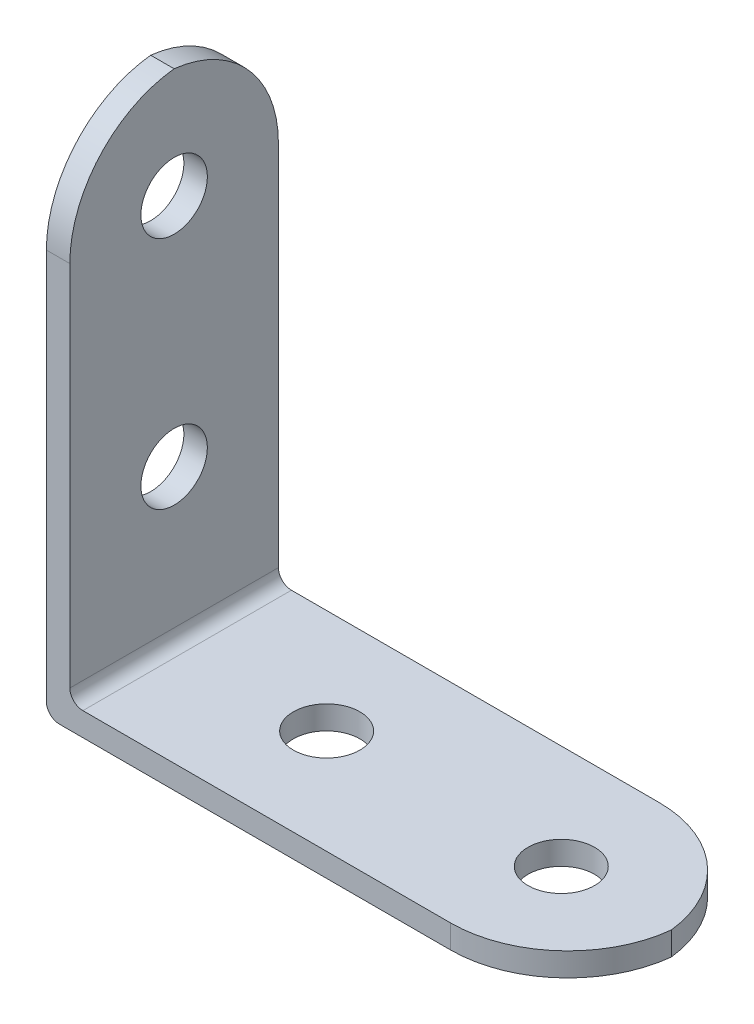
from build123d import *

# Parameters (mm, degrees)
CROQUIS1_W              = 16
CROQUIS1_H              = 40
CROQUIS1_R              = 2.55
SALIENTE_EXTRUIR1_DEPTH = 1.8
CROQUIS2_W              = 16
CROQUIS2_H              = 1.8
SALIENTE_EXTRUIR2_DEPTH = 38.2
CROQUIS3_R              = 2.55
CORTAR_EXTRUIR1_DEPTH   = 38.2
REDONDEO1_R             = 1
REDONDEO2_R             = 9
REDONDEO3_R             = 1


with BuildPart() as part:
    # Croquis1 → Saliente-Extruir1 (new body)
    with BuildSketch(Plane(origin=(0, 0, 0), x_dir=(0, 0, -1), z_dir=(1, 0, 0))):
        with Locations((-8, 20)):
            Rectangle(CROQUIS1_W, CROQUIS1_H)
        with Locations((-8, 31.5)):
            Circle(CROQUIS1_R, mode=Mode.SUBTRACT)
        with Locations((-8, 13.5)):
            Circle(CROQUIS1_R, mode=Mode.SUBTRACT)
    extrude(amount=SALIENTE_EXTRUIR1_DEPTH)

    # Croquis2 → Saliente-Extruir2 (add)
    with BuildSketch(Plane(origin=(1.8, 0, 0), x_dir=(0, 0, -1), z_dir=(1, 0, 0))):
        with Locations((-8, 0.9)):
            Rectangle(CROQUIS2_W, CROQUIS2_H)
    extrude(amount=SALIENTE_EXTRUIR2_DEPTH)

    # Croquis3 → Cortar-Extruir1 (cut)
    with BuildSketch(Plane(origin=(0, 1.8, 0), x_dir=(1, 0, 0), z_dir=(0, 1, 0))):
        with Locations(Location((31.5, -8, 0), (0, 0, 270))):
            Circle(CROQUIS3_R)
        with Locations(Location((13.5, -8, 0), (0, 0, 270))):
            Circle(CROQUIS3_R)
    extrude(amount=-CORTAR_EXTRUIR1_DEPTH, mode=Mode.SUBTRACT)

    # Redondeo1
    redondeo1_edges = [part.edges().sort_by_distance(p)[0] for p in [
        (1.8, 1.8, 8),
    ]]
    fillet(redondeo1_edges, radius=REDONDEO1_R)

    # Redondeo2
    # the kernel refuses this fillet: 9 mm, written as the material it takes off along each edge
    with BuildSketch(Plane(origin=(40, 24.3, 16), x_dir=(0, 0, -1), z_dir=(0, -1, 0)), Plane(origin=(-22.5, 40, 0), x_dir=(0, -1, 0), z_dir=(1, 0, 0)), Plane(origin=(-22.5, 40, 16), x_dir=(0, 0, -1), z_dir=(1, 0, 0))) as redondeo2_piece_1:
        with BuildLine():
            CenterArc((REDONDEO2_R, -REDONDEO2_R), REDONDEO2_R, 90, 90)
            Line((0, -REDONDEO2_R), (0, 0))
            Line((0, 0), (REDONDEO2_R, 0))
        make_face()
    extrude(amount=46.8, mode=Mode.SUBTRACT)
    with BuildSketch(Plane(origin=(40, -22.5, 0), x_dir=(-1, 0, 0), z_dir=(0, 1, 0))) as redondeo2_piece_2:
        with BuildLine():
            CenterArc((REDONDEO2_R, REDONDEO2_R), REDONDEO2_R, 180, 90)
            Line((0, REDONDEO2_R), (0, 0))
            Line((0, 0), (REDONDEO2_R, 0))
        make_face()
    extrude(amount=46.8, mode=Mode.SUBTRACT)

    # Redondeo3
    redondeo3_edges = [part.edges().sort_by_distance(p)[0] for p in [
        (0, 0, 8),
    ]]
    fillet(redondeo3_edges, radius=REDONDEO3_R)


solid = part.part
